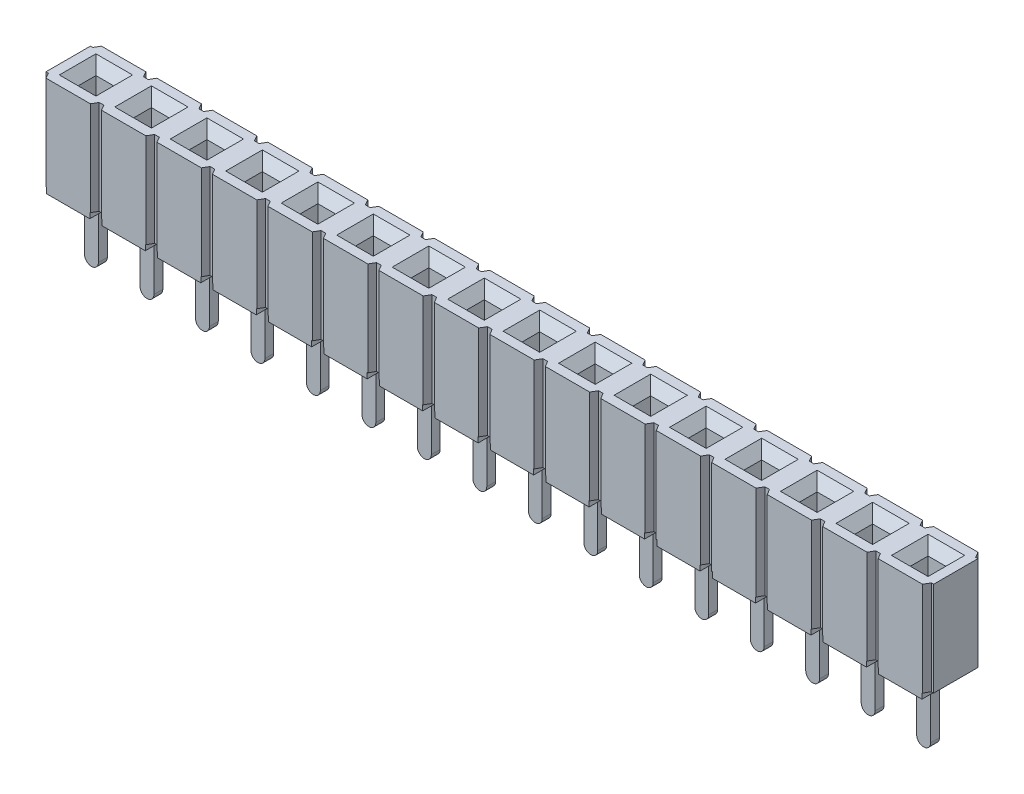
from build123d import *

# Parameters (mm, degrees)
SKETCH1_W                      = 40.64
SKETCH1_H                      = 2.54
BASE_EXTRUDE_DEPTH             = 4.572
SKETCH2_W                      = 1.524
SKETCH2_H                      = 0.254
STANDOFF_WIDTH_DEPTH           = 41.916080995
UPPER_START                    = -19.4945
UPPER_CORE_OUTLINE_W           = 3.3528
UPPER_CORE_OUTLINE_H           = 0.889
UPPER_CORE_DEPTH               = 0.889
LEAD_IN_SIZE                   = 0.3937
LEAD_IN_SIZE2                  = 0.469193389
CORE_PATTERN_COUNT             = 16
CORE_PATTERN_PITCH             = 2.54
LEAD_IN_OF_CORE_PATTERN_SIZE2  = 0.469193389
LEAD_IN_OF_CORE_PATTERN_SIZE   = 0.3937
POSITION_CUT_DEPTH             = 21.866683589
SKETCH10_W                     = 0.2794
SKETCH10_H                     = 0.254
STANDOFF_LENGTH_DEPTH          = 21.982306451
STANDOFF_PATTERN_COUNT         = 16
STANDOFF_PATTERN_PITCH         = 2.54
SKETCH11_W                     = 0.635
SKETCH11_H                     = 0.4064
TAIL_DEPTH                     = 3.175
TAIL_FILLETS_R                 = 0.3175
TAIL_PATTERN_COUNT             = 16
TAIL_PATTERN_PITCH             = 2.54
TAIL_FILLETS_OF_TAIL_PATTERN_R = 0.3175


# Read off the part's stored shape, not the designer's step: Upper Core
with BuildPart() as part:
    # Sketch1 → Base-Extrude (new body)
    with BuildSketch(Plane(origin=(0, 0, 0), x_dir=(1, 0, 0), z_dir=(0, 1, 0))):
        Rectangle(SKETCH1_W, SKETCH1_H)
    extrude(amount=BASE_EXTRUDE_DEPTH)

    # Sketch2 → Standoff - Width (cut, through all)
    with BuildSketch(Plane.ZY.offset(20.32)):
        with Locations((0, 0.127)):
            Rectangle(SKETCH2_W, SKETCH2_H)
    extrude(amount=-STANDOFF_WIDTH_DEPTH, mode=Mode.SUBTRACT)

    # Upper Core outline → Upper Core (cut)
    with BuildSketch(Plane.YZ.offset(UPPER_START)):
        with Locations((2.8956, 0)):
            Rectangle(UPPER_CORE_OUTLINE_W, UPPER_CORE_OUTLINE_H)
    upper_core = extrude(amount=UPPER_CORE_DEPTH, mode=Mode.SUBTRACT)

    # Lead-in
    lead_in_edges = [part.edges().sort_by_distance(p)[0] for p in [
        (-19.4945, 4.572, 0),
        (-19.05, 4.572, 0.4445),
        (-18.6055, 4.572, 0),
        (-19.05, 4.572, -0.4445),
    ]]
    lead_in_side = [part.faces().sort_by_distance(p)[0] for p in [
        (0.146976854, 4.572, 0),
    ]]
    chamfer(lead_in_edges, length=LEAD_IN_SIZE, length2=LEAD_IN_SIZE2, reference=lead_in_side[0])

    # Core Pattern: Upper Core ×16
    with Locations(*[(i * CORE_PATTERN_PITCH, 0, 0) for i in range(1, CORE_PATTERN_COUNT)]):
        add(upper_core, mode=Mode.SUBTRACT)

    # Lead-in of Core Pattern
    lead_in_of_core_pattern_edges = [part.edges().sort_by_distance(p)[0] for p in [
        (-16.9545, 4.572, 0),
        (-16.51, 4.572, 0.4445),
        (-16.0655, 4.572, 0),
        (-16.51, 4.572, -0.4445),
        (-14.4145, 4.572, 0),
        (-13.97, 4.572, 0.4445),
        (-13.5255, 4.572, 0),
        (-13.97, 4.572, -0.4445),
        (-11.8745, 4.572, 0),
        (-11.43, 4.572, 0.4445),
        (-10.9855, 4.572, 0),
        (-11.43, 4.572, -0.4445),
        (-9.3345, 4.572, 0),
        (-8.89, 4.572, 0.4445),
        (-8.4455, 4.572, 0),
        (-8.89, 4.572, -0.4445),
        (-6.7945, 4.572, 0),
        (-6.35, 4.572, 0.4445),
        (-5.9055, 4.572, 0),
        (-6.35, 4.572, -0.4445),
        (-4.2545, 4.572, 0),
        (-3.81, 4.572, 0.4445),
        (-3.3655, 4.572, 0),
        (-3.81, 4.572, -0.4445),
        (-1.7145, 4.572, 0),
        (-1.27, 4.572, 0.4445),
        (-0.8255, 4.572, 0),
        (-1.27, 4.572, -0.4445),
        (0.8255, 4.572, 0),
        (1.27, 4.572, 0.4445),
        (1.7145, 4.572, 0),
        (1.27, 4.572, -0.4445),
        (3.3655, 4.572, 0),
        (3.81, 4.572, 0.4445),
        (4.2545, 4.572, 0),
        (3.81, 4.572, -0.4445),
        (5.9055, 4.572, 0),
        (6.35, 4.572, 0.4445),
        (6.7945, 4.572, 0),
        (6.35, 4.572, -0.4445),
        (8.4455, 4.572, 0),
        (8.89, 4.572, 0.4445),
        (9.3345, 4.572, 0),
        (8.89, 4.572, -0.4445),
        (10.9855, 4.572, 0),
        (11.43, 4.572, 0.4445),
        (11.8745, 4.572, 0),
        (11.43, 4.572, -0.4445),
        (13.5255, 4.572, 0),
        (13.97, 4.572, 0.4445),
        (14.4145, 4.572, 0),
        (13.97, 4.572, -0.4445),
        (16.0655, 4.572, 0),
        (16.51, 4.572, 0.4445),
        (16.9545, 4.572, 0),
        (16.51, 4.572, -0.4445),
        (18.6055, 4.572, 0),
        (19.05, 4.572, 0.4445),
        (19.4945, 4.572, 0),
        (19.05, 4.572, -0.4445),
    ]]
    chamfer(lead_in_of_core_pattern_edges, length=LEAD_IN_OF_CORE_PATTERN_SIZE, length2=LEAD_IN_OF_CORE_PATTERN_SIZE2)

    # Sketch4 → Position Cut (cut, through all)
    with BuildSketch(Plane(origin=(0, 4.572, 0), x_dir=(-1, 0, 0), z_dir=(0, 1, 0))):
        Polygon((20.32, 1.016), (20.212646968, 1.016), (20.066, 1.27), (20.32, 1.27), align=None)
        Polygon((20.066, -1.27), (20.32, -1.27), (20.32, -1.016), (20.212646968, -1.016), align=None)
        Polygon((17.78, -1.016), (17.887353032, -1.016), (18.034, -1.27), (17.78, -1.27), align=None)
        Polygon((18.034, 1.27), (17.78, 1.27), (17.78, 1.016), (17.887353032, 1.016), align=None)
    position_cut = extrude(amount=-POSITION_CUT_DEPTH, mode=Mode.SUBTRACT)

    # Sketch10 → Standoff - Length (cut, through all)
    with BuildSketch(Plane.XY.offset(1.27)):
        with Locations((-17.9197, 0.127)):
            Rectangle(SKETCH10_W, SKETCH10_H)
        with Locations((-20.1803, 0.127)):
            Rectangle(SKETCH10_W, SKETCH10_H)
    standoff_length = extrude(amount=-STANDOFF_LENGTH_DEPTH, mode=Mode.SUBTRACT)

    # Standoff Pattern: Position Cut, Standoff - Length ×16
    with Locations(*[(i * STANDOFF_PATTERN_PITCH, 0, 0) for i in range(1, STANDOFF_PATTERN_COUNT)]):
        add(position_cut, mode=Mode.SUBTRACT)
        add(standoff_length, mode=Mode.SUBTRACT)

    # Sketch11 → Tail (add)
    with BuildSketch(Plane.XZ.offset(-0.254)):
        with Locations((-19.05, 0)):
            Rectangle(SKETCH11_W, SKETCH11_H)
    tail = extrude(amount=TAIL_DEPTH)

    # Tail Fillets
    tail_fillets_edges = [part.edges().sort_by_distance(p)[0] for p in [
        (-19.3675, -2.921, 0),
        (-18.7325, -2.921, 0),
    ]]
    fillet(tail_fillets_edges, radius=TAIL_FILLETS_R - 0.0001)  # a hair under: the kernel refuses the full size

    # Tail Pattern: Tail ×16
    with Locations(*[(i * TAIL_PATTERN_PITCH, 0, 0) for i in range(1, TAIL_PATTERN_COUNT)]):
        add(tail)

    # Tail Fillets of Tail Pattern
    tail_fillets_of_tail_pattern_edges = [part.edges().sort_by_distance(p)[0] for p in [
        (-16.8275, -2.921, 0),
        (-16.1925, -2.921, 0),
        (-14.2875, -2.921, 0),
        (-13.6525, -2.921, 0),
        (-11.7475, -2.921, 0),
        (-11.1125, -2.921, 0),
        (-9.2075, -2.921, 0),
        (-8.5725, -2.921, 0),
        (-6.6675, -2.921, 0),
        (-6.0325, -2.921, 0),
        (-4.1275, -2.921, 0),
        (-3.4925, -2.921, 0),
        (-1.5875, -2.921, 0),
        (-0.9525, -2.921, 0),
        (0.9525, -2.921, 0),
        (1.5875, -2.921, 0),
        (3.4925, -2.921, 0),
        (4.1275, -2.921, 0),
        (6.0325, -2.921, 0),
        (6.6675, -2.921, 0),
        (8.5725, -2.921, 0),
        (9.2075, -2.921, 0),
        (11.1125, -2.921, 0),
        (11.7475, -2.921, 0),
        (13.6525, -2.921, 0),
        (14.2875, -2.921, 0),
        (16.1925, -2.921, 0),
        (16.8275, -2.921, 0),
        (18.7325, -2.921, 0),
        (19.3675, -2.921, 0),
    ]]
    fillet(tail_fillets_of_tail_pattern_edges, radius=TAIL_FILLETS_OF_TAIL_PATTERN_R - 0.0001)  # a hair under: the kernel refuses the full size


solid = part.part
